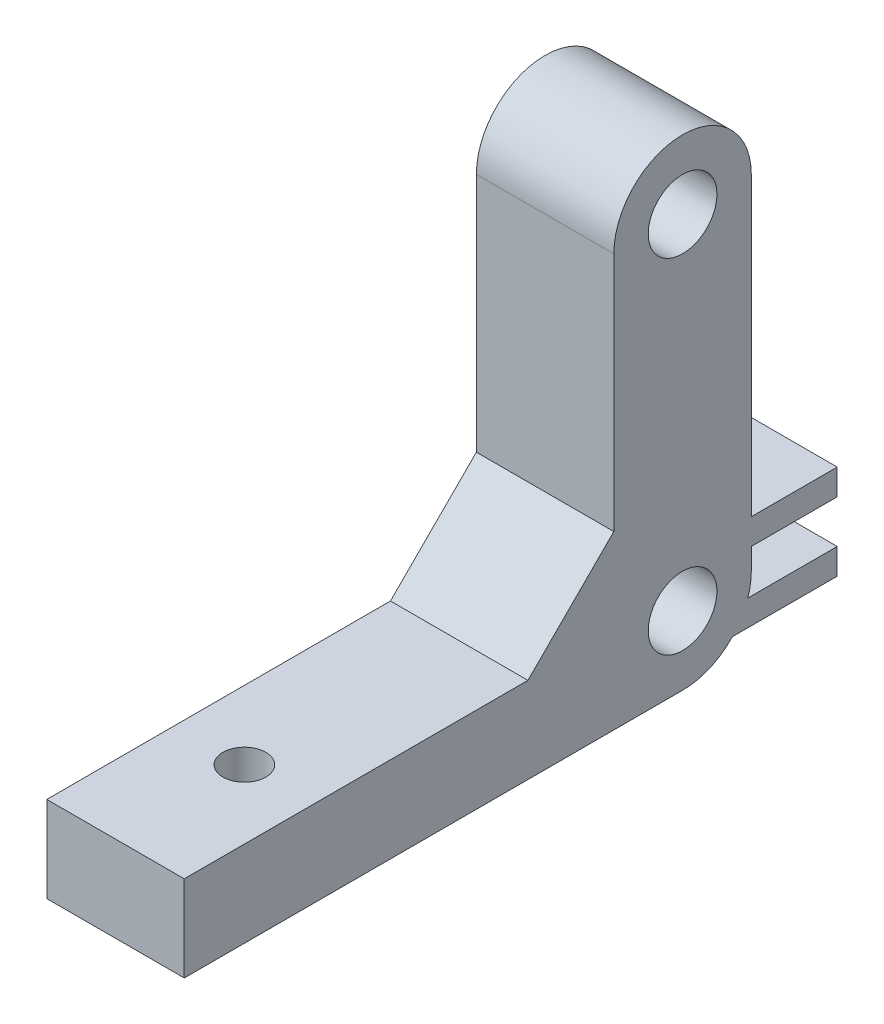
from build123d import *

# Parameters (mm, degrees)
SKETCH1_R           = 4
BOSS_EXTRUDE1_DEPTH = 16
SKETCH2_R           = 2.5
CUT_EXTRUDE1_DEPTH  = 77.491311533
SKETCH3_R           = 2
CUT_EXTRUDE2_DEPTH  = 75.439040429


with BuildPart() as part:
    # Sketch1 → Boss-Extrude1 (new body)
    with BuildSketch(Plane(origin=(0, 0, 0), x_dir=(0, 0, -1), z_dir=(1, 0, 0))):
        with BuildLine():
            Line((-10.309088451, -58.789851982), (-58.982376521, -58.789851982))
            Line((-58.982376521, -58.789851982), (-58.982376521, -48.789851982))
            Line((-58.982376521, -48.789851982), (-18.982376521, -48.789851982))
            Line((-18.982376521, -48.789851982), (-8.982376521, -38.789851982))
            Line((-8.982376521, -38.789851982), (-8.982376521, -10.789851982))
            ThreePointArc((-8.982376521, -10.789851982), (-0.982376521, -2.789851982), (7.017623479, -10.789851982))
            Line((7.017623479, -10.789851982), (7.017623479, -45.289851982))
            Line((7.017623479, -45.289851982), (17.017623479, -45.289851982))
            Line((17.017623479, -45.289851982), (17.017623479, -48.289851982))
            Line((17.017623479, -48.289851982), (7.017623479, -48.289851982))
            Line((7.017623479, -48.289851982), (7.017623479, -50.789851982))
            ThreePointArc((7.017623479, -50.789851982), (6.916823965, -52.055802887), (6.616965556, -53.289851982))
            Line((6.616965556, -53.289851982), (17.017623479, -53.289851982))
            Line((17.017623479, -53.289851982), (17.017623479, -56.289851982))
            Line((17.017623479, -56.289851982), (4.827098499, -56.289851982))
            ThreePointArc((4.827098499, -56.289851982), (2.179901139, -58.138321211), (-0.982376521, -58.789851982))
            Line((-0.982376521, -58.789851982), (-10.309088451, -58.789851982))
        make_face()
        with Locations((-0.982376521, -10.789851982)):
            Circle(SKETCH1_R, mode=Mode.SUBTRACT)
        with Locations((-0.982376521, -50.789851982)):
            Circle(SKETCH1_R, mode=Mode.SUBTRACT)
    extrude(amount=-BOSS_EXTRUDE1_DEPTH)

    # Sketch2 → Cut-Extrude1 (cut, through all)
    with BuildSketch(Plane(origin=(0, -48.789851982, 0), x_dir=(1, 0, 0), z_dir=(0, 1, 0))):
        with Locations((-8, -43.982376521)):
            Circle(SKETCH2_R)
    extrude(amount=-CUT_EXTRUDE1_DEPTH, mode=Mode.SUBTRACT)

    # Sketch3 → Cut-Extrude2 (cut, through all)
    with BuildSketch(Plane(origin=(0, -45.289851982, 0), x_dir=(1, 0, 0), z_dir=(0, 1, 0))):
        with Locations((-8, 12.017623479)):
            Circle(SKETCH3_R)
    extrude(amount=-CUT_EXTRUDE2_DEPTH, mode=Mode.SUBTRACT)


solid = part.part
